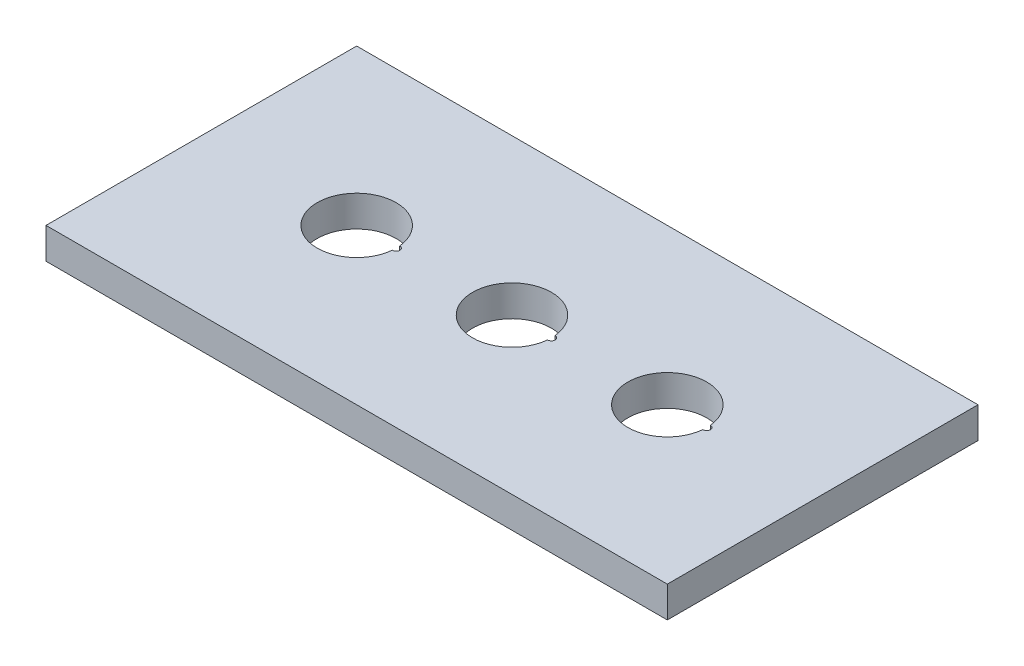
from build123d import *

# Parameters (mm, degrees)
SKETCH1_W           = 100
SKETCH1_H           = 50
BOSS_EXTRUDE1_DEPTH = 5


with BuildPart() as part:
    # Sketch1 → Boss-Extrude1 (new body)
    with BuildSketch(Plane(origin=(0, 0, 0), x_dir=(1, 0, 0), z_dir=(0, 1, 0))):
        Rectangle(SKETCH1_W, SKETCH1_H)
        with BuildLine():
            ThreePointArc((31.321653543, 0.599330025), (31.95, 0), (31.321653543, -0.599330025))
            ThreePointArc((31.321653543, -0.599330025), (18.65, 0), (31.321653543, 0.599330025))
        make_face(mode=Mode.SUBTRACT)
        with BuildLine():
            ThreePointArc((6.321653543, 0.599330025), (6.95, 0), (6.321653543, -0.599330025))
            ThreePointArc((6.321653543, -0.599330025), (-6.35, 0), (6.321653543, 0.599330025))
        make_face(mode=Mode.SUBTRACT)
        with BuildLine():
            ThreePointArc((-18.678346457, 0.599330025), (-18.05, 0), (-18.678346457, -0.599330025))
            ThreePointArc((-18.678346457, -0.599330025), (-31.35, 0), (-18.678346457, 0.599330025))
        make_face(mode=Mode.SUBTRACT)
    extrude(amount=BOSS_EXTRUDE1_DEPTH)


solid = part.part
